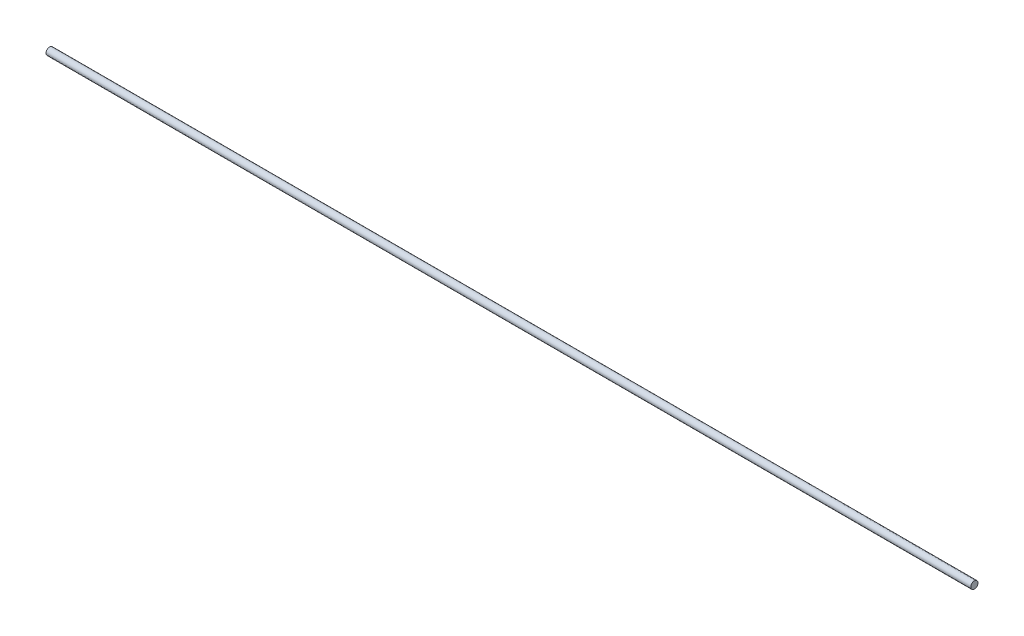
from build123d import *

# Parameters (mm, degrees)
SKETCH1_R           = 3.175
BOSS_EXTRUDE1_DEPTH = 812.8


with BuildPart() as part:
    # Sketch1 → Boss-Extrude1 (new body)
    with BuildSketch(Plane(origin=(0, 0, 0), x_dir=(0, 0, -1), z_dir=(1, 0, 0))):
        Circle(SKETCH1_R)
    extrude(amount=BOSS_EXTRUDE1_DEPTH)


solid = part.part
